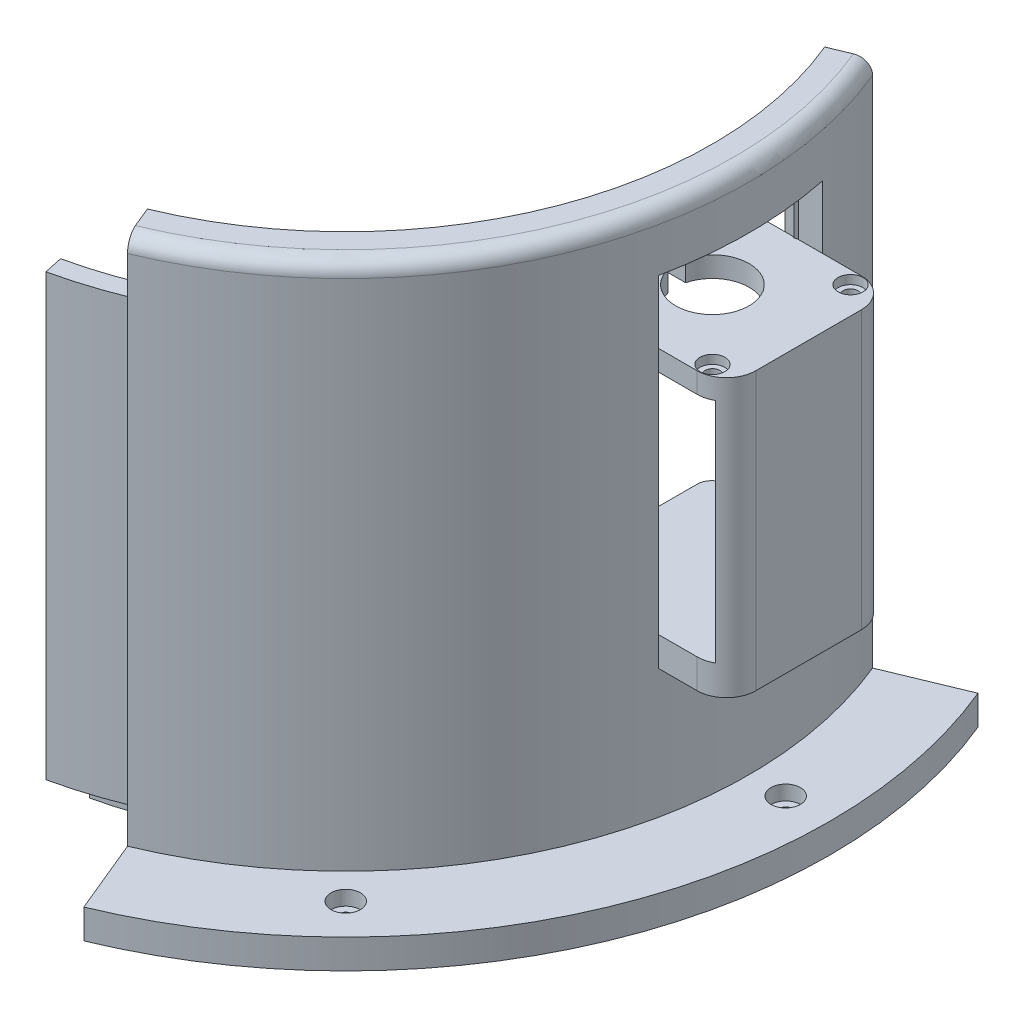
from build123d import *

# Parameters (mm, degrees)
SKETCH1_R           = 137.5
SKETCH1_R_2         = 125
BOSS_EXTRUDE1_DEPTH = 180
SKETCH2_R           = 165
SKETCH2_R_2         = 2.5
BOSS_EXTRUDE2_DEPTH = 10
SKETCH3_R           = 52.5
SKETCH3_R_2         = 47.5
BOSS_EXTRUDE3_DEPTH = 20
SKETCH4_W           = 56
SKETCH4_H           = 106
CUT_EXTRUDE4_DEPTH  = 150
SKETCH5_W           = 56
SKETCH5_H           = 7
BOSS_EXTRUDE4_DEPTH = 56
SKETCH6_W           = 56
SKETCH6_H           = 56
BOSS_EXTRUDE5_DEPTH = 10
SKETCH7_R           = 2.5
SKETCH7_R_2         = 12.5
CUT_EXTRUDE5_DEPTH  = 10
SKETCH8_W           = 56
SKETCH8_H           = 94.5
BOSS_EXTRUDE6_DEPTH = 5
FILLET1_R           = 10
FILLET2_R           = 5
SKETCH9_W           = 32.130677801
SKETCH9_H           = 6
CUT_EXTRUDE6_DEPTH  = 10
FILLET3_R           = 5
CUT_EXTRUDE7_START  = -3
SKETCH10_R          = 47.5
CUT_EXTRUDE7_DEPTH  = 3
SKETCH11_R          = 5
CUT_EXTRUDE8_DEPTH  = 5
SKETCH13_W          = 14
SKETCH13_H          = 12
CUT_EXTRUDE9_DEPTH  = 301.915270467
SKETCH15_W          = 6.5
SKETCH15_H          = 150
SKETCH15_W_2        = 60
SKETCH15_H_2        = 4
REVOLVE1_ANGLE      = 10
SKETCH16_W          = 6.5
SKETCH16_H          = 150
SKETCH16_W_2        = 60
SKETCH16_H_2        = 4
CUT_REVOLVE2_ANGLE  = 10
SKETCH17_R          = 40
CUT_EXTRUDE10_DEPTH = 3
SKETCH18_R          = 4.25
CUT_EXTRUDE12_DEPTH = 3


with BuildPart() as part:
    # Sketch1 → Boss-Extrude1 (new body)
    with BuildSketch(Plane(origin=(0, 0, 0), x_dir=(1, 0, 0), z_dir=(0, 1, 0))):
        with Locations(Location((0, 0, 0), (0, 0, 90))):
            Circle(SKETCH1_R)
        with Locations(Location((0, 0, 0), (0, 0, 90))):
            Circle(SKETCH1_R_2, mode=Mode.SUBTRACT)
    extrude(amount=BOSS_EXTRUDE1_DEPTH)

    # Sketch2 → Boss-Extrude2 (add)
    with BuildSketch(Plane.XZ):
        with Locations(Location((0, 0, 0), (0, 0, 270))):
            Circle(SKETCH2_R)
        with Locations(Location((0, 150, 0), (0, 0, 270))):
            Circle(SKETCH2_R_2, mode=Mode.SUBTRACT)
        with Locations(Location((0, 30, 0), (0, 0, 270))):
            Circle(SKETCH2_R_2, mode=Mode.SUBTRACT)
        with Locations(Location((106.066017178, 106.066017178, 0), (0, 0, 270))):
            Circle(SKETCH2_R_2, mode=Mode.SUBTRACT)
        with Locations(Location((150, 0, 0), (0, 0, 270))):
            Circle(SKETCH2_R_2, mode=Mode.SUBTRACT)
        with Locations(Location((106.066017178, -106.066017178, 0), (0, 0, 270))):
            Circle(SKETCH2_R_2, mode=Mode.SUBTRACT)
        with Locations(Location((0, -150, 0), (0, 0, 270))):
            Circle(SKETCH2_R_2, mode=Mode.SUBTRACT)
        with Locations(Location((-106.066017178, -106.066017178, 0), (0, 0, 270))):
            Circle(SKETCH2_R_2, mode=Mode.SUBTRACT)
        with Locations(Location((-150, 0, 0), (0, 0, 270))):
            Circle(SKETCH2_R_2, mode=Mode.SUBTRACT)
        with Locations(Location((-106.066017178, 106.066017178, 0), (0, 0, 270))):
            Circle(SKETCH2_R_2, mode=Mode.SUBTRACT)
        with Locations(Location((21.213203436, 21.213203436, 0), (0, 0, 270))):
            Circle(SKETCH2_R_2, mode=Mode.SUBTRACT)
        with Locations(Location((30, 0, 0), (0, 0, 270))):
            Circle(SKETCH2_R_2, mode=Mode.SUBTRACT)
        with Locations(Location((21.213203436, -21.213203436, 0), (0, 0, 270))):
            Circle(SKETCH2_R_2, mode=Mode.SUBTRACT)
        with Locations(Location((0, -30, 0), (0, 0, 270))):
            Circle(SKETCH2_R_2, mode=Mode.SUBTRACT)
        with Locations(Location((-21.213203436, -21.213203436, 0), (0, 0, 270))):
            Circle(SKETCH2_R_2, mode=Mode.SUBTRACT)
        with Locations(Location((-30, 0, 0), (0, 0, 270))):
            Circle(SKETCH2_R_2, mode=Mode.SUBTRACT)
        with Locations(Location((-21.213203436, 21.213203436, 0), (0, 0, 270))):
            Circle(SKETCH2_R_2, mode=Mode.SUBTRACT)
    extrude(amount=BOSS_EXTRUDE2_DEPTH)

    # Sketch3 → Boss-Extrude3 (add)
    with BuildSketch(Plane(origin=(0, 0, 0), x_dir=(1, 0, 0), z_dir=(0, 1, 0))):
        with Locations(Location((0, 0, 0), (0, 0, 90))):
            Circle(SKETCH3_R)
        with Locations(Location((0, 0, 0), (0, 0, 270))):
            Circle(SKETCH3_R_2, mode=Mode.SUBTRACT)
    extrude(amount=BOSS_EXTRUDE3_DEPTH)

    # Sketch4 → Cut-Extrude4 (cut)
    with BuildSketch(Plane(origin=(0, 0, 0), x_dir=(0, 0, -1), z_dir=(1, 0, 0))):
        with Locations((0, 107)):
            Rectangle(SKETCH4_W, SKETCH4_H)
    extrude(amount=CUT_EXTRUDE4_DEPTH, mode=Mode.SUBTRACT)

    # Sketch5 → Boss-Extrude4 (add)
    with BuildSketch(Plane(origin=(0, 0, 28), x_dir=(-1, 0, 0), z_dir=(0, 0, -1))):
        with Locations((-124.823643025, 135)):
            Rectangle(SKETCH5_W, SKETCH5_H)
    extrude(amount=BOSS_EXTRUDE4_DEPTH)

    # Sketch6 → Boss-Extrude5 (add)
    with BuildSketch(Plane(origin=(0, 54, 0), x_dir=(1, 0, 0), z_dir=(0, 1, 0))):
        with Locations((124.823643025, 0)):
            Rectangle(SKETCH6_W, SKETCH6_H)
    extrude(amount=-BOSS_EXTRUDE5_DEPTH)

    # Sketch7 → Cut-Extrude5 (cut)
    with BuildSketch(Plane(origin=(0, 138.5, 0), x_dir=(1, 0, 0), z_dir=(0, 1, 0))):
        with Locations(Location((101.473643025, 23.55, 0), (0, 0, 270))):
            Circle(SKETCH7_R)
        with Locations(Location((148.573643025, 23.55, 0), (0, 0, 270))):
            Circle(SKETCH7_R)
        with Locations(Location((101.473643025, -23.55, 0), (0, 0, 270))):
            Circle(SKETCH7_R)
        with Locations(Location((148.573643025, -23.55, 0), (0, 0, 270))):
            Circle(SKETCH7_R)
        with Locations(Location((125.023643025, 0, 0), (0, 0, 270))):
            Circle(SKETCH7_R_2)
    extrude(amount=-CUT_EXTRUDE5_DEPTH, mode=Mode.SUBTRACT)

    # Sketch8 → Boss-Extrude6 (add)
    with BuildSketch(Plane(origin=(152.823643025, 0, 0), x_dir=(0, 0, -1), z_dir=(1, 0, 0))):
        with Locations((0, 91.25)):
            Rectangle(SKETCH8_W, SKETCH8_H)
    extrude(amount=BOSS_EXTRUDE6_DEPTH)

    # Fillet1
    # the kernel refuses this fillet: 10 mm, written as the material it takes off along each edge
    with BuildSketch(Plane(origin=(157.823643025, 163.5, -28), x_dir=(0, 0, 1), z_dir=(0, -1, 0))) as fillet1_piece_1:
        with BuildLine():
            CenterArc((FILLET1_R, FILLET1_R), FILLET1_R, 180, 90)
            Line((0, FILLET1_R), (0, 0))
            Line((0, 0), (FILLET1_R, 0))
        make_face()
    extrude(amount=144.5, mode=Mode.SUBTRACT)
    with BuildSketch(Plane(origin=(157.823643025, 19, 28), x_dir=(-1, 0, 0), z_dir=(0, 1, 0))) as fillet1_piece_2:
        with BuildLine():
            CenterArc((FILLET1_R, -FILLET1_R), FILLET1_R, 90, 90)
            Line((0, -FILLET1_R), (0, 0))
            Line((0, 0), (FILLET1_R, 0))
        make_face()
    extrude(amount=144.5, mode=Mode.SUBTRACT)

    # Fillet2
    fillet2_edges = [part.edges().sort_by_distance(p)[0] for p in [
        (96.823643025, 49, 28),
        (96.823643025, 49, -28),
        (96.823643025, 135, -28),
        (96.823643025, 135, 28),
    ]]
    fillet(fillet2_edges, radius=FILLET2_R)

    # Sketch9 → Cut-Extrude6 (cut)
    with BuildSketch(Plane(origin=(0, 138.5, 0), x_dir=(1, 0, 0), z_dir=(0, 1, 0))):
        with Locations((96.823643026, 0)):
            Rectangle(SKETCH9_W, SKETCH9_H)
    extrude(amount=-CUT_EXTRUDE6_DEPTH, mode=Mode.SUBTRACT)

    # Fillet3
    fillet3_edges = [part.edges().sort_by_distance(p)[0] for p in [
        (0, 180, 137.5),
    ]]
    fillet(fillet3_edges, radius=FILLET3_R)

    # Sketch10 → Cut-Extrude7 (cut)
    with BuildSketch(Plane(origin=(0, 0, 0), x_dir=(1, 0, 0), z_dir=(0, 1, 0)).offset(CUT_EXTRUDE7_START)):
        with Locations(Location((0, 0, 0), (0, 0, 270))):
            Circle(SKETCH10_R)
    extrude(amount=CUT_EXTRUDE7_DEPTH, mode=Mode.SUBTRACT)

    # Sketch11 → Cut-Extrude8 (cut)
    with BuildSketch(Plane(origin=(0, 0, 0), x_dir=(1, 0, 0), z_dir=(0, 1, 0))):
        with Locations(Location((0, 150, 0), (0, 0, 270))):
            Circle(SKETCH11_R)
        with Locations(Location((106.066017178, 106.066017178, 0), (0, 0, 270))):
            Circle(SKETCH11_R)
        with Locations(Location((150, 0, 0), (0, 0, 270))):
            Circle(SKETCH11_R)
        with Locations(Location((106.066017178, -106.066017178, 0), (0, 0, 270))):
            Circle(SKETCH11_R)
        with Locations(Location((0, -150, 0), (0, 0, 270))):
            Circle(SKETCH11_R)
        with Locations(Location((-106.066017178, -106.066017178, 0), (0, 0, 270))):
            Circle(SKETCH11_R)
        with Locations(Location((-150, 0, 0), (0, 0, 270))):
            Circle(SKETCH11_R)
        with Locations(Location((-106.066017178, 106.066017178, 0), (0, 0, 270))):
            Circle(SKETCH11_R)
    extrude(amount=-CUT_EXTRUDE8_DEPTH, mode=Mode.SUBTRACT)

    # Sketch13 → Cut-Revolve1 (revolve, cut)
    with BuildSketch(Plane.XY, mode=Mode.PRIVATE) as cut_revolve1_sk:
        with Locations((-125, 170)):
            Rectangle(SKETCH13_W, SKETCH13_H)
    revolve(cut_revolve1_sk.sketch.rotate(Axis((0, 0, 0), (0, 1, 0)), 90), axis=Axis((0, 0, 0), (0, 1, 0)), mode=Mode.SUBTRACT)

    # Sketch14 → Cut-Extrude9 (cut, through all)
    with BuildSketch(Plane(origin=(0, 180, 0), x_dir=(1, 0, 0), z_dir=(0, 1, 0))):
        with BuildLine():
            ThreePointArc((-50.705554788, 122.414038058), (50.705554788, 122.414038058), (122.414038058, 50.705554788))
            Line((122.414038058, 50.705554788), (152.440122864, 63.14276634))
            ThreePointArc((152.440122864, 63.14276634), (63.14276634, 152.440122864), (-63.14276634, 152.440122864))
            Line((-63.14276634, 152.440122864), (-50.705554788, 122.414038058))
        make_face()
        with BuildLine():
            ThreePointArc((-47.835429046, 115.484941564), (47.835429046, 115.484941564), (115.484941564, 47.835429046))
            Line((115.484941564, 47.835429046), (122.414038058, 50.705554788))
            ThreePointArc((122.414038058, 50.705554788), (50.705554788, 122.414038058), (-50.705554788, 122.414038058))
            Line((-50.705554788, 122.414038058), (-47.835429046, 115.484941564))
        make_face()
        with BuildLine():
            Line((-47.835429046, 115.484941564), (0, 0))
            Line((0, 0), (115.484941564, 47.835429046))
            ThreePointArc((115.484941564, 47.835429046), (47.835429046, 115.484941564), (-47.835429046, 115.484941564))
        make_face()
        with BuildLine():
            ThreePointArc((-122.414038058, -50.705554788), (-122.414038058, 50.705554788), (-50.705554788, 122.414038058))
            Line((-50.705554788, 122.414038058), (-63.14276634, 152.440122864))
            ThreePointArc((-63.14276634, 152.440122864), (-152.440122864, 63.14276634), (-152.440122864, -63.14276634))
            Line((-152.440122864, -63.14276634), (-122.414038058, -50.705554788))
        make_face()
        with BuildLine():
            ThreePointArc((-115.484941564, -47.835429046), (-115.484941564, 47.835429046), (-47.835429046, 115.484941564))
            Line((-47.835429046, 115.484941564), (-50.705554788, 122.414038058))
            ThreePointArc((-50.705554788, 122.414038058), (-122.414038058, 50.705554788), (-122.414038058, -50.705554788))
            Line((-122.414038058, -50.705554788), (-115.484941564, -47.835429046))
        make_face()
        with BuildLine():
            Line((-115.484941564, -47.835429046), (0, 0))
            Line((0, 0), (-47.835429046, 115.484941564))
            ThreePointArc((-47.835429046, 115.484941564), (-115.484941564, 47.835429046), (-115.484941564, -47.835429046))
        make_face()
        with BuildLine():
            Line((47.835429046, -115.484941564), (0, 0))
            Line((0, 0), (-115.484941564, -47.835429046))
            ThreePointArc((-115.484941564, -47.835429046), (-47.835429046, -115.484941564), (47.835429046, -115.484941564))
        make_face()
        with BuildLine():
            ThreePointArc((47.835429046, -115.484941564), (-47.835429046, -115.484941564), (-115.484941564, -47.835429046))
            Line((-115.484941564, -47.835429046), (-122.414038058, -50.705554788))
            ThreePointArc((-122.414038058, -50.705554788), (-50.705554788, -122.414038058), (50.705554788, -122.414038058))
            Line((50.705554788, -122.414038058), (47.835429046, -115.484941564))
        make_face()
        with BuildLine():
            ThreePointArc((50.705554788, -122.414038058), (-50.705554788, -122.414038058), (-122.414038058, -50.705554788))
            Line((-122.414038058, -50.705554788), (-152.440122864, -63.14276634))
            ThreePointArc((-152.440122864, -63.14276634), (-63.14276634, -152.440122864), (63.14276634, -152.440122864))
            Line((63.14276634, -152.440122864), (50.705554788, -122.414038058))
        make_face()
    extrude(amount=-CUT_EXTRUDE9_DEPTH, mode=Mode.SUBTRACT)

    # Sketch15 → Revolve1 (revolve)
    with BuildSketch(Plane(origin=(0, 0, 0), x_dir=(0.38268343236509106, 0, 0.9238795325112863), z_dir=(-0.9238795325112862, 0, 0.382683432365091))):
        with Locations((131.25, 85)):
            Rectangle(SKETCH15_W, SKETCH15_H)
        with Locations((85, -5)):
            Rectangle(SKETCH15_W_2, SKETCH15_H_2)
    revolve(axis=Axis((0, 0, 0), (0, -1, 0)), revolution_arc=REVOLVE1_ANGLE)

    # Sketch16 → Cut-Revolve2 (revolve, cut)
    with BuildSketch(Plane(origin=(0, 0, 0), x_dir=(-0.9238795325112865, 0, 0.38268343236509034), z_dir=(-0.38268343236509034, 0, -0.9238795325112865))):
        with Locations((-131.25, 85)):
            Rectangle(SKETCH16_W, SKETCH16_H)
        with Locations((-85, -5)):
            Rectangle(SKETCH16_W_2, SKETCH16_H_2)
    revolve(axis=Axis((0, 0, 0), (0, -1, 0)), revolution_arc=CUT_REVOLVE2_ANGLE, mode=Mode.SUBTRACT)

    # Sketch17 → Cut-Extrude10 (cut)
    with BuildSketch(Plane(origin=(0, -10, 0), x_dir=(-1, 0, 0), z_dir=(0, -1, 0))):
        Circle(SKETCH17_R)
    extrude(amount=-CUT_EXTRUDE10_DEPTH, mode=Mode.SUBTRACT)

    # Sketch18 → Cut-Extrude12 (cut)
    with BuildSketch(Plane(origin=(0, 138.5, 0), x_dir=(1, 0, 0), z_dir=(0, 1, 0))):
        with Locations(Location((101.473643025, 23.55, 0), (0, 0, 270))):
            Circle(SKETCH18_R)
        with Locations(Location((148.573643025, 23.55, 0), (0, 0, 270))):
            Circle(SKETCH18_R)
        with Locations(Location((101.473643025, -23.55, 0), (0, 0, 270))):
            Circle(SKETCH18_R)
        with Locations(Location((148.573643025, -23.55, 0), (0, 0, 270))):
            Circle(SKETCH18_R)
    extrude(amount=-CUT_EXTRUDE12_DEPTH, mode=Mode.SUBTRACT)


solid = part.part
